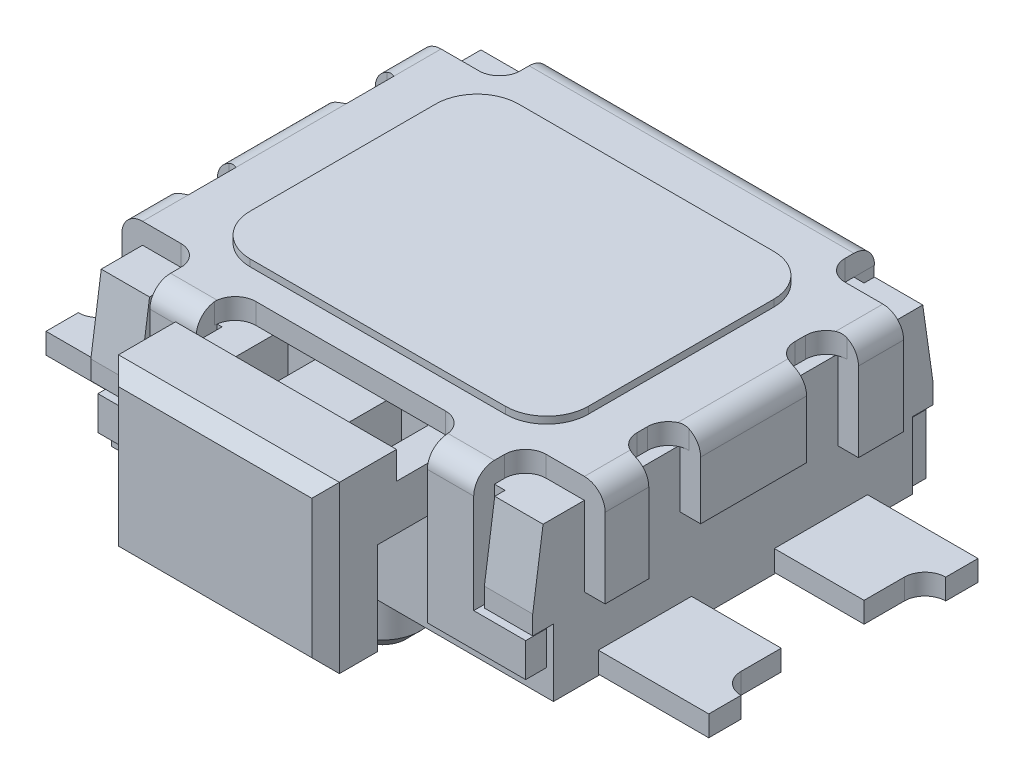
from build123d import *

# Parameters (mm, degrees)
SKETCH1_W           = 3.5
SKETCH1_H           = 2.9
BOSS_EXTRUDE1_DEPTH = 1.3
FILLET1_R           = 0.15
CUT_EXTRUDE1_DEPTH  = 0.15
SKETCH3_W           = 0.374492705
SKETCH3_H           = 1.15
SKETCH3_W_2         = 0.363687425
CUT_EXTRUDE2_DEPTH  = 0.15
SKETCH5_W           = 0.4271747
SKETCH5_H           = 0.718195939
CUT_EXTRUDE3_DEPTH  = 0.15
SKETCH8_W           = 1.673716776
SKETCH8_H           = 0.418001907
SKETCH8_W_2         = 0.4271747
SKETCH8_H_2         = 0.718195939
CUT_EXTRUDE5_DEPTH  = 0.15
SKETCH9_W           = 0.050909436
SKETCH9_H           = 0.431804061
CUT_EXTRUDE6_DEPTH  = 0.15
BOSS_EXTRUDE2_DEPTH = 0.35
SKETCH11_W          = 2.16181987
SKETCH11_H          = 0.575
CUT_EXTRUDE7_DEPTH  = 0.15
BOSS_EXTRUDE3_DEPTH = 0.05
BOSS_EXTRUDE4_DEPTH = 0.8
CUT_EXTRUDE8_DEPTH  = 0.329794357
CHAMFER1_SIZE       = 0.1
SKETCH15_W          = 0.675
SKETCH15_H          = 0.15
BOSS_EXTRUDE5_DEPTH = 0.8
SKETCH16_W          = 0.441416309
SKETCH16_H          = 0.15
CUT_EXTRUDE9_DEPTH  = 0.15
FILLET2_R           = 0.15
SKETCH17_R          = 0.275
BOSS_EXTRUDE6_DEPTH = 0.5
CHAMFER2_SIZE       = 0.1


with BuildPart() as part:
    # Sketch1 → Boss-Extrude1 (new body)
    with BuildSketch(Plane(origin=(0, 0, 0), x_dir=(1, 0, 0), z_dir=(0, 1, 0))):
        Rectangle(SKETCH1_W, SKETCH1_H)
    extrude(amount=BOSS_EXTRUDE1_DEPTH)

    # Fillet1
    fillet1_edges = [part.edges().sort_by_distance(p)[0] for p in [
        (-1.75, 1.3, 0),
        (0, 1.3, 1.45),
        (1.75, 1.3, 0),
        (0, 1.3, -1.45),
    ]]
    fillet(fillet1_edges, radius=FILLET1_R)

    # Sketch2 → Cut-Extrude1 (cut)
    with BuildSketch(Plane(origin=(0, 1.3, 0), x_dir=(1, 0, 0), z_dir=(0, 1, 0))):
        Polygon((-1.175959837, 1.45), (-1.75, 1.45), (-1.75, 1.086312575), (-1.6, 1.086312575), (-1.6, 1.3), (-1.175959837, 1.3), align=None)
        with BuildLine():
            Line((-1.6, -0.743935916), (-1.6, -0.399083945))
            ThreePointArc((-1.6, -0.399083945), (-1.632243532, -0.387564022), (-1.666259451, -0.383656175))
            Line((-1.666259451, -0.383656175), (-1.75, -0.383656175))
            Line((-1.75, -0.383656175), (-1.75, -0.759363686))
            Line((-1.75, -0.759363686), (-1.666259451, -0.759363686))
            ThreePointArc((-1.666259451, -0.759363686), (-1.632243532, -0.75545584), (-1.6, -0.743935916))
        make_face()
        with BuildLine():
            Line((-1.6, 0.399083945), (-1.6, 0.743935916))
            ThreePointArc((-1.6, 0.743935916), (-1.632243532, 0.75545584), (-1.666259451, 0.759363686))
            Line((-1.666259451, 0.759363686), (-1.75, 0.759363686))
            Line((-1.75, 0.759363686), (-1.75, 0.383656175))
            Line((-1.75, 0.383656175), (-1.666259451, 0.383656175))
            ThreePointArc((-1.666259451, 0.383656175), (-1.632243532, 0.387564022), (-1.6, 0.399083945))
        make_face()
        with BuildLine():
            Line((-1.3228253, -1.075507295), (-1.6, -1.075507295))
            Line((-1.6, -1.075507295), (-1.6, -1.3))
            Line((-1.6, -1.3), (-1.1728253, -1.3))
            Line((-1.1728253, -1.3), (-1.1728253, -1.225507295))
            ThreePointArc((-1.1728253, -1.225507295), (-1.216759283, -1.119441277), (-1.3228253, -1.075507295))
        make_face()
        with BuildLine():
            Line((0, -1.3), (-0.835758444, -1.3))
            ThreePointArc((-0.835758444, -1.3), (-0.83658315, -1.309049389), (-0.836858388, -1.31813211))
            Line((-0.836858388, -1.31813211), (-0.836858388, -1.45))
            Line((-0.836858388, -1.45), (0, -1.45))
            Line((0, -1.45), (0, -1.3))
        make_face()
        with BuildLine():
            Line((0.835758444, -1.3), (0, -1.3))
            Line((0, -1.3), (0, -1.45))
            Line((0, -1.45), (0.836858388, -1.45))
            Line((0.836858388, -1.45), (0.836858388, -1.31813211))
            ThreePointArc((0.836858388, -1.31813211), (0.83658315, -1.309049389), (0.835758444, -1.3))
        make_face()
        with BuildLine():
            ThreePointArc((1.666259451, -0.383656175), (1.632243532, -0.387564022), (1.6, -0.399083945))
            Line((1.6, -0.399083945), (1.6, -0.743935916))
            ThreePointArc((1.6, -0.743935916), (1.632243532, -0.75545584), (1.666259451, -0.759363686))
            Line((1.666259451, -0.759363686), (1.75, -0.759363686))
            Line((1.75, -0.759363686), (1.75, -0.383656175))
            Line((1.75, -0.383656175), (1.666259451, -0.383656175))
        make_face()
        with BuildLine():
            ThreePointArc((1.666259451, 0.759363686), (1.632243532, 0.75545584), (1.6, 0.743935916))
            Line((1.6, 0.743935916), (1.6, 0.399083945))
            ThreePointArc((1.6, 0.399083945), (1.632243532, 0.387564022), (1.666259451, 0.383656175))
            Line((1.666259451, 0.383656175), (1.75, 0.383656175))
            Line((1.75, 0.383656175), (1.75, 0.759363686))
            Line((1.75, 0.759363686), (1.666259451, 0.759363686))
        make_face()
        with BuildLine():
            Line((1.6, 1.3), (1.175959837, 1.3))
            Line((1.175959837, 1.3), (1.175959837, 1.236312575))
            ThreePointArc((1.175959837, 1.236312575), (1.219893819, 1.130246558), (1.325959837, 1.086312575))
            Line((1.325959837, 1.086312575), (1.6, 1.086312575))
            Line((1.6, 1.086312575), (1.6, 1.3))
        make_face()
        Polygon((1.175959837, 1.45), (1.175959837, 1.3), (1.6, 1.3), (1.6, 1.086312575), (1.75, 1.086312575), (1.75, 1.45), align=None)
        with BuildLine():
            Line((1.6, 0.399083945), (1.6, 0.743935916))
            ThreePointArc((1.6, 0.743935916), (1.538903812, 0.688613552), (1.516259451, 0.609363686))
            Line((1.516259451, 0.609363686), (1.516259451, 0.533656175))
            ThreePointArc((1.516259451, 0.533656175), (1.538903812, 0.454406309), (1.6, 0.399083945))
        make_face()
        with BuildLine():
            Line((1.6, -0.743935916), (1.6, -0.399083945))
            ThreePointArc((1.6, -0.399083945), (1.538903812, -0.454406309), (1.516259451, -0.533656175))
            Line((1.516259451, -0.533656175), (1.516259451, -0.609363686))
            ThreePointArc((1.516259451, -0.609363686), (1.538903812, -0.688613552), (1.6, -0.743935916))
        make_face()
        with BuildLine():
            Line((0, -1.16813211), (0, -1.3))
            Line((0, -1.3), (0.835758444, -1.3))
            ThreePointArc((0.835758444, -1.3), (0.786307329, -1.205838262), (0.686858388, -1.16813211))
            Line((0.686858388, -1.16813211), (0, -1.16813211))
        make_face()
        with BuildLine():
            ThreePointArc((-0.686858388, -1.16813211), (-0.786307329, -1.205838262), (-0.835758444, -1.3))
            Line((-0.835758444, -1.3), (0, -1.3))
            Line((0, -1.3), (0, -1.16813211))
            Line((0, -1.16813211), (-0.686858388, -1.16813211))
        make_face()
        Polygon((-1.6, -1.3), (-1.6, -1.075507295), (-1.75, -1.075507295), (-1.75, -1.45), (-1.1728253, -1.45), (-1.1728253, -1.3), align=None)
        with BuildLine():
            Line((-1.175959837, 1.236312575), (-1.175959837, 1.3))
            Line((-1.175959837, 1.3), (-1.6, 1.3))
            Line((-1.6, 1.3), (-1.6, 1.086312575))
            Line((-1.6, 1.086312575), (-1.325959837, 1.086312575))
            ThreePointArc((-1.325959837, 1.086312575), (-1.219893819, 1.130246558), (-1.175959837, 1.236312575))
        make_face()
        Polygon((1.75, -1.075507295), (1.6, -1.075507295), (1.6, -1.3), (1.1728253, -1.3), (1.1728253, -1.45), (1.75, -1.45), align=None)
        with BuildLine():
            Line((1.6, -1.3), (1.6, -1.075507295))
            Line((1.6, -1.075507295), (1.3228253, -1.075507295))
            ThreePointArc((1.3228253, -1.075507295), (1.216759283, -1.119441277), (1.1728253, -1.225507295))
            Line((1.1728253, -1.225507295), (1.1728253, -1.3))
            Line((1.1728253, -1.3), (1.6, -1.3))
        make_face()
    extrude(amount=-CUT_EXTRUDE1_DEPTH, mode=Mode.SUBTRACT)

    # Sketch3 → Cut-Extrude2 (cut)
    with BuildSketch(Plane.ZY.offset(1.75)):
        Polygon((-0.759363686, 1.15), (-0.383656175, 1.15), (-0.383656175, 0.731592752), (0.383656175, 0.731592752), (0.383656175, 1.15), (0.759363686, 1.15), (0.759363686, 0), (0.383656175, 0), (-0.383656175, 0), (-0.759363686, 0), align=None)
        with Locations((1.262753648, 0.575)):
            Rectangle(SKETCH3_W, SKETCH3_H)
        with Locations((-1.268156288, 0.575)):
            Rectangle(SKETCH3_W_2, SKETCH3_H)
    cut_extrude2 = extrude(amount=-CUT_EXTRUDE2_DEPTH, mode=Mode.SUBTRACT)

    # Mirror1: Cut-Extrude2 across plane
    add(cut_extrude2.mirror(Plane(origin=(0, 0, 0), x_dir=(0, 0, 1), z_dir=(1, 0, 0))), mode=Mode.SUBTRACT)

    # Sketch5 → Cut-Extrude3 (cut)
    with BuildSketch(Plane.XY.offset(1.45)):
        Polygon((-0.836858388, 1.15), (0.836858388, 1.15), (0.836858388, 0.187187202), (1.6, 0.187187202), (1.6, 0), (0.836858388, 0), (-0.836858388, 0), (-1.6, 0), (-1.6, 0.187187202), (-0.836858388, 0.187187202), align=None)
        with Locations((1.38641265, 0.790902031)):
            Rectangle(SKETCH5_W, SKETCH5_H)
        with Locations((-1.38641265, 0.790902031)):
            Rectangle(SKETCH5_W, SKETCH5_H)
    extrude(amount=-CUT_EXTRUDE3_DEPTH, mode=Mode.SUBTRACT)

    # Sketch8 → Cut-Extrude5 (cut)
    with BuildSketch(Plane(origin=(0, 0, -1.45), x_dir=(-1, 0, 0), z_dir=(0, 0, -1))):
        with Locations((0, 0.209000954)):
            Rectangle(SKETCH8_W, SKETCH8_H)
        with Locations((-1.38641265, 0.790902031)):
            Rectangle(SKETCH8_W_2, SKETCH8_H_2)
        with Locations((1.38641265, 0.790902031)):
            Rectangle(SKETCH8_W_2, SKETCH8_H_2)
    extrude(amount=-CUT_EXTRUDE5_DEPTH, mode=Mode.SUBTRACT)

    # Sketch9 → Cut-Extrude6 (cut)
    with BuildSketch(Plane.XY.offset(1.45)):
        with Locations((-1.574545282, 0.215902031)):
            Rectangle(SKETCH9_W, SKETCH9_H)
        with Locations((1.574545282, 0.215902031)):
            Rectangle(SKETCH9_W, SKETCH9_H)
    cut_extrude6 = extrude(amount=-CUT_EXTRUDE6_DEPTH, mode=Mode.SUBTRACT)

    # Mirror2: Cut-Extrude6 across plane
    add(cut_extrude6.mirror(Plane.XY), mode=Mode.SUBTRACT)

    # Sketch10 → Boss-Extrude2 (add)
    with BuildSketch(Plane.ZY.offset(1.6)):
        Polygon((-1.3, 1.15), (-1.375, 1.15), (-1.45, 0.624134115), (-1.45, 0.486562482), (-1.3, 0.486562482), align=None)
        Polygon((1.45, 0.486562482), (1.3, 0.486562482), (1.3, 1.15), (1.375, 1.15), (1.45, 0.624134115), align=None)
    boss_extrude2 = extrude(amount=-BOSS_EXTRUDE2_DEPTH)

    # Mirror3: Boss-Extrude2 across plane
    add(boss_extrude2.mirror(Plane(origin=(0, 0, 0), x_dir=(0, 0, 1), z_dir=(1, 0, 0))))

    # Sketch11 → Cut-Extrude7 (cut)
    with BuildSketch(Plane.ZY.offset(1.75)):
        with Locations((-0.00540264, 0.2875)):
            Rectangle(SKETCH11_W, SKETCH11_H)
    cut_extrude7 = extrude(amount=-CUT_EXTRUDE7_DEPTH, mode=Mode.SUBTRACT)

    # Mirror4: Cut-Extrude7 across plane
    add(cut_extrude7.mirror(Plane(origin=(0, 0, 0), x_dir=(0, 0, 1), z_dir=(1, 0, 0))), mode=Mode.SUBTRACT)

    # Sketch12 → Boss-Extrude3 (add)
    with BuildSketch(Plane(origin=(0, 1.3, 0), x_dir=(1, 0, 0), z_dir=(0, 1, 0))):
        with BuildLine():
            Line((-0.924135319, 0.971791635), (0.924135319, 0.971791635))
            ThreePointArc((0.924135319, 0.971791635), (1.136267354, 0.883923669), (1.224135319, 0.671791635))
            Line((1.224135319, 0.671791635), (1.224135319, -0.671791635))
            ThreePointArc((1.224135319, -0.671791635), (1.136267354, -0.883923669), (0.924135319, -0.971791635))
            Line((0.924135319, -0.971791635), (-0.924135319, -0.971791635))
            ThreePointArc((-0.924135319, -0.971791635), (-1.136267354, -0.883923669), (-1.224135319, -0.671791635))
            Line((-1.224135319, -0.671791635), (-1.224135319, 0.671791635))
            ThreePointArc((-1.224135319, 0.671791635), (-1.136267354, 0.883923669), (-0.924135319, 0.971791635))
        make_face()
    extrude(amount=BOSS_EXTRUDE3_DEPTH)

    # Sketch13 → Boss-Extrude4 (add, symmetric)
    with BuildSketch(Plane(origin=(0, 0, 0), x_dir=(0, 0, -1), z_dir=(1, 0, 0))):
        Polygon((-1.3, 1.15), (-1.636654748, 1.15), (-1.636654748, 1.35), (-2.15, 1.35), (-2.15, 0.15), (-1.773551733, 0.15), (-1.773551733, 0.820205643), (-1.3, 0.820205643), align=None)
    extrude(amount=BOSS_EXTRUDE4_DEPTH, both=True)

    # Sketch14 → Cut-Extrude8 (cut)
    with BuildSketch(Plane(origin=(0, 1.15, 0), x_dir=(1, 0, 0), z_dir=(0, 1, 0))):
        Polygon((-0.376844509, -1.636654748), (-0.563499257, -1.45), (-0.563499257, -1.16813211), (-0.563499257, -1.059656098), (-0.257760164, -1.059656098), (-0.257760164, -1.636654748), align=None)
        Polygon((0.257760164, -1.059656098), (0.257760164, -1.636654748), (0.376844509, -1.636654748), (0.563499257, -1.45), (0.563499257, -1.16813211), (0.563499257, -1.059656098), align=None)
    extrude(amount=-CUT_EXTRUDE8_DEPTH, mode=Mode.SUBTRACT)

    # Chamfer1
    chamfer1_edges = [part.edges().sort_by_distance(p)[0] for p in [
        (-0.8, 0.75, 2.15),
        (0, 1.35, 2.15),
        (0, 0.15, 2.15),
        (0.8, 0.75, 2.15),
    ]]
    chamfer(chamfer1_edges, length=CHAMFER1_SIZE)

    # Sketch15 → Boss-Extrude5 (add)
    with BuildSketch(Plane(origin=(1.6, 0, 0), x_dir=(0, 0, -1), z_dir=(1, 0, 0))):
        with Locations((-0.6375, 0.085)):
            Rectangle(SKETCH15_W, SKETCH15_H)
        with Locations((0.6375, 0.085)):
            Rectangle(SKETCH15_W, SKETCH15_H)
    boss_extrude5 = extrude(amount=BOSS_EXTRUDE5_DEPTH)

    # Mirror5: Boss-Extrude5 across plane
    add(boss_extrude5.mirror(Plane(origin=(0, 0, 0), x_dir=(0, 0, 1), z_dir=(1, 0, 0))))

    # Sketch16 → Cut-Extrude9 (cut)
    with BuildSketch(Plane(origin=(2.4, 0, 0), x_dir=(0, 0, -1), z_dir=(1, 0, 0))):
        with Locations((-0.520708155, 0.085)):
            Rectangle(SKETCH16_W, SKETCH16_H)
        with Locations((0.520708155, 0.085)):
            Rectangle(SKETCH16_W, SKETCH16_H)
    cut_extrude9 = extrude(amount=-CUT_EXTRUDE9_DEPTH, mode=Mode.SUBTRACT)

    # Mirror6: Cut-Extrude9 across plane
    add(cut_extrude9.mirror(Plane(origin=(0, 0, 0), x_dir=(0, 0, 1), z_dir=(1, 0, 0))), mode=Mode.SUBTRACT)

    # Fillet2
    fillet2_edges = [part.edges().sort_by_distance(p)[0] for p in [
        (2.25, 0.085, -0.741416309),
        (2.25, 0.085, 0.741416309),
        (-2.25, 0.085, 0.741416309),
        (-2.25, 0.085, -0.741416309),
    ]]
    fillet(fillet2_edges, radius=FILLET2_R - 0.0001)  # a hair under: the kernel refuses the full size

    # Sketch17 → Boss-Extrude6 (add)
    with BuildSketch(Plane.XZ):
        with Locations(Location((0, 0.94, 0), (0, 0, 90))):
            Circle(SKETCH17_R)
        with Locations(Location((0, -0.94, 0), (0, 0, 90))):
            Circle(SKETCH17_R)
    extrude(amount=BOSS_EXTRUDE6_DEPTH)

    # Chamfer2
    chamfer2_edges = [part.edges().sort_by_distance(p)[0] for p in [
        (0, -0.5, 0.665),
        (0, -0.5, -1.215),
    ]]
    chamfer(chamfer2_edges, length=CHAMFER2_SIZE)


solid = part.part
